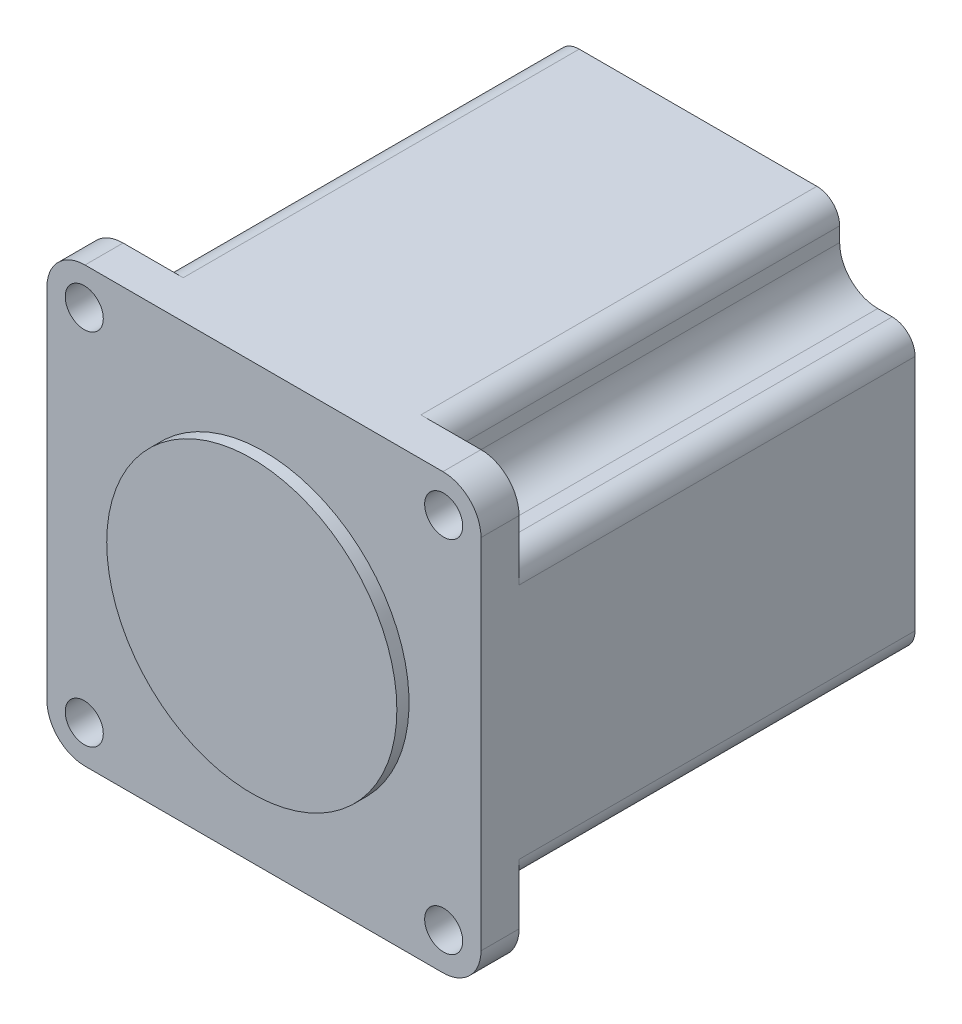
from build123d import *

# Parameters (mm, degrees)
BOSS_EXTRUDE1_DEPTH = 2.5
SKETCH5_R           = 2.5
CUT_EXTRUDE1_DEPTH  = 41.614036982
SKETCH3_R           = 19.05
BOSS_EXTRUDE3_DEPTH = 1.6
BODY_DEPTH          = 52


with BuildPart() as part:
    # Sketch1 → Boss-Extrude1 (new, symmetric)
    with BuildSketch(Plane.XY):
        with BuildLine():
            Line((-23.5, -28.5), (23.5, -28.5))
            ThreePointArc((23.5, -28.5), (27.035533906, -27.035533906), (28.5, -23.5))
            Line((28.5, -23.5), (28.5, 23.5))
            ThreePointArc((28.5, 23.5), (27.035533906, 27.035533906), (23.5, 28.5))
            Line((23.5, 28.5), (-23.5, 28.5))
            ThreePointArc((-23.5, 28.5), (-27.035533906, 27.035533906), (-28.5, 23.5))
            Line((-28.5, 23.5), (-28.5, -23.5))
            ThreePointArc((-28.5, -23.5), (-27.035533906, -27.035533906), (-23.5, -28.5))
        make_face()
    extrude(amount=BOSS_EXTRUDE1_DEPTH, both=True)

    # Sketch5 → Cut-Extrude1 (cut, through all)
    with BuildSketch(Plane.XY.offset(2.5)):
        with Locations((-23.6, 23.6)):
            Circle(SKETCH5_R)
        with Locations((23.6, 23.6)):
            Circle(SKETCH5_R)
        with Locations((23.6, -23.6)):
            Circle(SKETCH5_R)
        with Locations((-23.6, -23.6)):
            Circle(SKETCH5_R)
    extrude(amount=-CUT_EXTRUDE1_DEPTH, mode=Mode.SUBTRACT)

    # Sketch3 → Boss-Extrude3 (add)
    with BuildSketch(Plane.XY.offset(2.5)):
        Circle(SKETCH3_R)
    extrude(amount=BOSS_EXTRUDE3_DEPTH)

    # Sketch4 → Body (add)
    with BuildSketch(Plane(origin=(0, 0, -2.5), x_dir=(-1, 0, 0), z_dir=(0, 0, -1))):
        with BuildLine():
            Line((-18.6, 23.6), (-18.6, 25.5))
            ThreePointArc((-18.6, 25.5), (-17.721320344, 27.621320344), (-15.6, 28.5))
            Line((-15.6, 28.5), (15.6, 28.5))
            ThreePointArc((15.6, 28.5), (17.721320344, 27.621320344), (18.6, 25.5))
            Line((18.6, 25.5), (18.6, 23.6))
            ThreePointArc((18.6, 23.6), (20.064466094, 20.064466094), (23.6, 18.6))
            Line((23.6, 18.6), (25.5, 18.6))
            ThreePointArc((25.5, 18.6), (27.621320344, 17.721320344), (28.5, 15.6))
            Line((28.5, 15.6), (28.5, -15.6))
            ThreePointArc((28.5, -15.6), (27.621320344, -17.721320344), (25.5, -18.6))
            Line((25.5, -18.6), (23.6, -18.6))
            ThreePointArc((23.6, -18.6), (20.064466094, -20.064466094), (18.6, -23.6))
            Line((18.6, -23.6), (18.6, -25.5))
            ThreePointArc((18.6, -25.5), (17.721320344, -27.621320344), (15.6, -28.5))
            Line((15.6, -28.5), (-15.6, -28.5))
            ThreePointArc((-15.6, -28.5), (-17.721320344, -27.621320344), (-18.6, -25.5))
            Line((-18.6, -25.5), (-18.6, -23.6))
            ThreePointArc((-18.6, -23.6), (-20.064466094, -20.064466094), (-23.6, -18.6))
            Line((-23.6, -18.6), (-25.5, -18.6))
            ThreePointArc((-25.5, -18.6), (-27.621320344, -17.721320344), (-28.5, -15.6))
            Line((-28.5, -15.6), (-28.5, 15.6))
            ThreePointArc((-28.5, 15.6), (-27.621320344, 17.721320344), (-25.5, 18.6))
            Line((-25.5, 18.6), (-23.6, 18.6))
            ThreePointArc((-23.6, 18.6), (-20.064466094, 20.064466094), (-18.6, 23.6))
        make_face()
    extrude(amount=BODY_DEPTH)


solid = part.part
